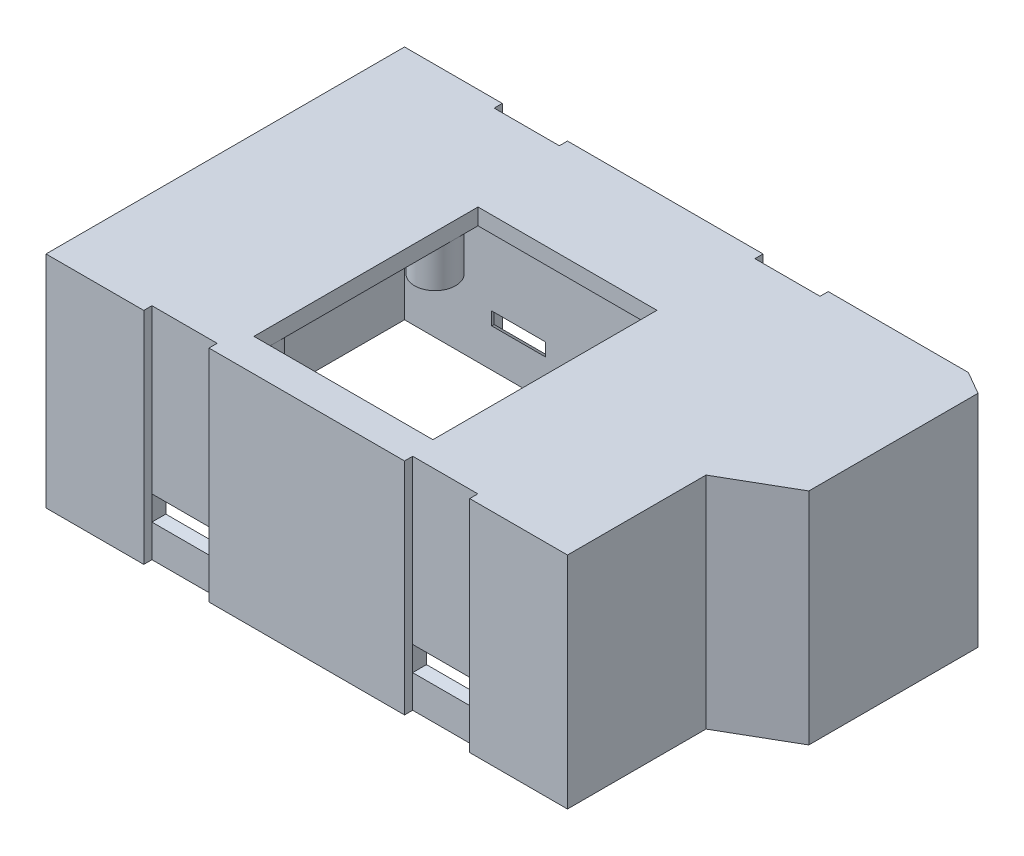
from build123d import *

# Parameters (mm, degrees)
SKETCH1_W               = 60
SKETCH1_H               = 40
BOSS_EXTRUDE1_DEPTH     = 27
SKETCH2_W               = 8
SKETCH2_H               = 3
CUT_EXTRUDE1_DEPTH      = 1
CUT_EXTRUDE1_DRAFT      = -35
MIRROR1_COPY_1_SKETCH_W = 8
MIRROR1_COPY_1_SKETCH_H = 3
MIRROR1_COPY_1_DEPTH    = 1
MIRROR1_COPY_1_DRAFT    = -35
MIRROR2_COPY_1_SKETCH_W = 8
MIRROR2_COPY_1_SKETCH_H = 3
MIRROR2_COPY_1_DEPTH    = 1
MIRROR2_COPY_1_DRAFT    = -35
MIRROR2_COPY_2_SKETCH_W = 8
MIRROR2_COPY_2_SKETCH_H = 3
MIRROR2_COPY_2_DEPTH    = 1
MIRROR2_COPY_2_DRAFT    = -35
BOSS_EXTRUDE2_START     = 27
SKETCH1_3_W             = 60
SKETCH1_3_H             = 40
BOSS_EXTRUDE2_DEPTH     = 2
SKETCH3_W               = 21.960696684
SKETCH3_H               = 27.5
CUT_EXTRUDE2_DEPTH      = 2
SKETCH3_3_R             = 2.5
SKETCH3_3_R_2           = 1.4
SKETCH3_3_R_3           = 2.519651658
BOSS_EXTRUDE3_DEPTH     = 5
SKETCH4_W               = 20
SKETCH4_H               = 27
BOSS_EXTRUDE4_DEPTH     = 8
CHAMFER1_SIZE           = 5
CHAMFER1_SIZE_2         = 8.660254038
SKETCH5_W               = 8
SKETCH5_H               = 20
CUT_EXTRUDE3_DEPTH      = 25
SKETCH6_W               = 12
SKETCH6_H               = 40
CUT_EXTRUDE5_DEPTH      = 1.5


with BuildPart() as part:
    # Sketch1 → Boss-Extrude1 (new body)
    with BuildSketch(Plane(origin=(0, 0, 0), x_dir=(1, 0, 0), z_dir=(0, 1, 0))):
        Polygon((-32, 22), (-20, 22), (-20, 21), (-12, 21), (-12, 22), (12, 22), (12, 21), (20, 21), (20, 22), (32, 22), (32, -22), (20, -22), (20, -21), (12, -21), (12, -22), (-12, -22), (-12, -21), (-20, -21), (-20, -22), (-32, -22), align=None)
        Rectangle(SKETCH1_W, SKETCH1_H, mode=Mode.SUBTRACT)
    extrude(amount=BOSS_EXTRUDE1_DEPTH)


with BuildPart() as cut_extrude1_tool:
    # Sketch2 → Cut-Extrude1 (with draft: the straight prism first)
    with BuildSketch(Plane.XY.offset(21)):
        with Locations((-16, 5.5)):
            Rectangle(SKETCH2_W, SKETCH2_H)
    extrude(amount=-CUT_EXTRUDE1_DEPTH)
    # Cut-Extrude1: the draft: its side faces are tilted about the plane it starts from
    cut_extrude1_sides = [cut_extrude1_tool.faces().sort_by_distance(p)[0] for p in [
        (-20, 5.5, 20.5),
        (-16, 4, 20.5),
        (-12, 5.5, 20.5),
        (-16, 7, 20.5),
    ]]
    draft(cut_extrude1_sides, Plane.XY.offset(21), CUT_EXTRUDE1_DRAFT)


with BuildPart() as part_1:
    add(part.part)

    # Cut-Extrude1: cut by cut_extrude1_tool
    add(cut_extrude1_tool.part, mode=Mode.SUBTRACT)


with BuildPart() as mirror1_copy_1_tool:
    # Mirror1 copy 1 sketch → Mirror1 copy 1 (with draft: the straight prism first)
    with BuildSketch(Plane(origin=(0, 0, 21), x_dir=(-1, 0, 0), z_dir=(0, 0, 1))):
        with Locations((-16, -5.5)):
            Rectangle(MIRROR1_COPY_1_SKETCH_W, MIRROR1_COPY_1_SKETCH_H)
    extrude(amount=-MIRROR1_COPY_1_DEPTH)
    # Mirror1 copy 1: the draft: its side faces are tilted about the plane it starts from
    mirror1_copy_1_sides = [mirror1_copy_1_tool.faces().sort_by_distance(p)[0] for p in [
        (20, 5.5, 20.5),
        (16, 4, 20.5),
        (12, 5.5, 20.5),
        (16, 7, 20.5),
    ]]
    draft(mirror1_copy_1_sides, Plane(origin=(0, 0, 21), x_dir=(-1, 0, 0), z_dir=(0, 0, 1)), MIRROR1_COPY_1_DRAFT)


with BuildPart() as part_2:
    add(part_1.part)

    # Mirror1 copy 1: cut by mirror1_copy_1_tool
    add(mirror1_copy_1_tool.part, mode=Mode.SUBTRACT)


with BuildPart() as mirror2_copy_1_tool:
    # Mirror2 copy 1 sketch → Mirror2 copy 1 (with draft: the straight prism first)
    with BuildSketch(Plane(origin=(0, 0, -21), x_dir=(1, 0, 0), z_dir=(0, 0, -1))):
        with Locations((-16, -5.5)):
            Rectangle(MIRROR2_COPY_1_SKETCH_W, MIRROR2_COPY_1_SKETCH_H)
    extrude(amount=-MIRROR2_COPY_1_DEPTH)
    # Mirror2 copy 1: the draft: its side faces are tilted about the plane it starts from
    mirror2_copy_1_sides = [mirror2_copy_1_tool.faces().sort_by_distance(p)[0] for p in [
        (-20, 5.5, -20.5),
        (-16, 4, -20.5),
        (-12, 5.5, -20.5),
        (-16, 7, -20.5),
    ]]
    draft(mirror2_copy_1_sides, Plane(origin=(0, 0, -21), x_dir=(1, 0, 0), z_dir=(0, 0, -1)), MIRROR2_COPY_1_DRAFT)


with BuildPart() as part_3:
    add(part_2.part)

    # Mirror2 copy 1: cut by mirror2_copy_1_tool
    add(mirror2_copy_1_tool.part, mode=Mode.SUBTRACT)


with BuildPart() as mirror2_copy_2_tool:
    # Mirror2 copy 2 sketch → Mirror2 copy 2 (with draft: the straight prism first)
    with BuildSketch(Plane(origin=(0, 0, -21), x_dir=(-1, 0, 0), z_dir=(0, 0, -1))):
        with Locations((-16, 5.5)):
            Rectangle(MIRROR2_COPY_2_SKETCH_W, MIRROR2_COPY_2_SKETCH_H)
    extrude(amount=-MIRROR2_COPY_2_DEPTH)
    # Mirror2 copy 2: the draft: its side faces are tilted about the plane it starts from
    mirror2_copy_2_sides = [mirror2_copy_2_tool.faces().sort_by_distance(p)[0] for p in [
        (20, 5.5, -20.5),
        (16, 4, -20.5),
        (12, 5.5, -20.5),
        (16, 7, -20.5),
    ]]
    draft(mirror2_copy_2_sides, Plane(origin=(0, 0, -21), x_dir=(-1, 0, 0), z_dir=(0, 0, -1)), MIRROR2_COPY_2_DRAFT)


with BuildPart() as part_4:
    add(part_3.part)

    # Mirror2 copy 2: cut by mirror2_copy_2_tool
    add(mirror2_copy_2_tool.part, mode=Mode.SUBTRACT)

    # Sketch1<3> → Boss-Extrude2 (add)
    with BuildSketch(Plane(origin=(0, 0, 0), x_dir=(1, 0, 0), z_dir=(0, 1, 0)).offset(BOSS_EXTRUDE2_START)):
        Rectangle(SKETCH1_3_W, SKETCH1_3_H)
    extrude(amount=-BOSS_EXTRUDE2_DEPTH)

    # Sketch3 → Cut-Extrude2 (cut)
    with BuildSketch(Plane.XZ.offset(-25)):
        with Locations((0.5, 4.25)):
            Rectangle(SKETCH3_W, SKETCH3_H)
    extrude(amount=-CUT_EXTRUDE2_DEPTH, mode=Mode.SUBTRACT)

    # Sketch3<3> → Boss-Extrude3 (add)
    # profile 1 of 4: a face of its own
    with BuildSketch(Plane.XZ.offset(-25)):
        with Locations(Location((-13, 15.25, 0), (0, 0, 90))):
            Circle(SKETCH3_3_R)
        with Locations(Location((-13, 15.25, 0), (0, 0, 270))):
            Circle(SKETCH3_3_R_2, mode=Mode.SUBTRACT)
    # profile 2 of 4: a face of its own
    with BuildSketch(Plane.XZ.offset(-25)):
        with Locations((-13, -6.75)):
            Circle(SKETCH3_3_R_3)
        with Locations(Location((-13, -6.75, 0), (0, 0, 270))):
            Circle(SKETCH3_3_R_2, mode=Mode.SUBTRACT)
    # profile 3 of 4: a face of its own
    with BuildSketch(Plane.XZ.offset(-25)):
        with Locations(Location((14, -6.75, 0), (0, 0, 180))):
            Circle(SKETCH3_3_R_3)
        with Locations(Location((14, -6.75, 0), (0, 0, 270))):
            Circle(SKETCH3_3_R_2, mode=Mode.SUBTRACT)
    # profile 4 of 4: a face of its own
    with BuildSketch(Plane.XZ.offset(-25)):
        with Locations(Location((14, 15.25, 0), (0, 0, 90))):
            Circle(SKETCH3_3_R)
        with Locations(Location((14, 15.25, 0), (0, 0, 270))):
            Circle(SKETCH3_3_R_2, mode=Mode.SUBTRACT)
    extrude(amount=BOSS_EXTRUDE3_DEPTH)

    # Sketch4 → Boss-Extrude4 (add)
    with BuildSketch(Plane(origin=(32, 0, 0), x_dir=(0, 0, -1), z_dir=(1, 0, 0))):
        with Locations((10, 13.5)):
            Rectangle(SKETCH4_W, SKETCH4_H)
    extrude(amount=BOSS_EXTRUDE4_DEPTH)

    # Chamfer1
    # the kernel refuses this chamfer: 8.660254038, 5 mm, written as the material it adds along each edge
    with BuildSketch(Plane(origin=(32, 27, -20), x_dir=(-0.05789386240267251, 0, -0.9983227437537924), z_dir=(0, -1, 0))) as chamfer1_piece_1_section:
        Polygon((CHAMFER1_SIZE * 0.998322743754, CHAMFER1_SIZE * 0.0578938624027), (-CHAMFER1_SIZE_2 * 0.0578938624016, CHAMFER1_SIZE_2 * 0.998322743736), (0, 0), align=None)
    chamfer1_piece_1 = extrude(amount=27, mode=Mode.PRIVATE)
    chamfer1_piece_1 = split(chamfer1_piece_1, bisect_by=Plane(origin=(35.513912711, 13.5, -22), z_dir=(0, 0, 1)), keep=Keep.TOP, mode=Mode.PRIVATE)
    chamfer1_piece_1 = split(chamfer1_piece_1, bisect_by=Plane(origin=(40, 13.5, -20.824917772), z_dir=(-1, 0, 0)), keep=Keep.TOP, mode=Mode.PRIVATE)
    add(chamfer1_piece_1)
    with BuildSketch(Plane(origin=(32, 0, 0), x_dir=(-0.05789386240267113, 0, 0.9983227437537926), z_dir=(0, 1, 0))) as chamfer1_piece_2_section:
        Polygon((CHAMFER1_SIZE * 0.998322743754, CHAMFER1_SIZE * 0.0578938624027), (-CHAMFER1_SIZE_2 * 0.0578938624016, CHAMFER1_SIZE_2 * 0.998322743736), (0, 0), align=None)
    chamfer1_piece_2 = extrude(amount=27, mode=Mode.PRIVATE)
    chamfer1_piece_2 = split(chamfer1_piece_2, bisect_by=Plane(origin=(40, 13.5, 1.631661659), z_dir=(-1, 0, 0)), keep=Keep.TOP, mode=Mode.PRIVATE)
    add(chamfer1_piece_2)

    # Sketch5 → Cut-Extrude3 (cut)
    with BuildSketch(Plane.XZ):
        with Locations((34, -10)):
            Rectangle(SKETCH5_W, SKETCH5_H)
    extrude(amount=-CUT_EXTRUDE3_DEPTH, mode=Mode.SUBTRACT)

    # Sketch6 → Cut-Extrude5 (cut)
    with BuildSketch(Plane.XZ.offset(-25)):
        with Locations((24, 0)):
            Rectangle(SKETCH6_W, SKETCH6_H)
    extrude(amount=-CUT_EXTRUDE5_DEPTH, mode=Mode.SUBTRACT)


solid = part_4.part
